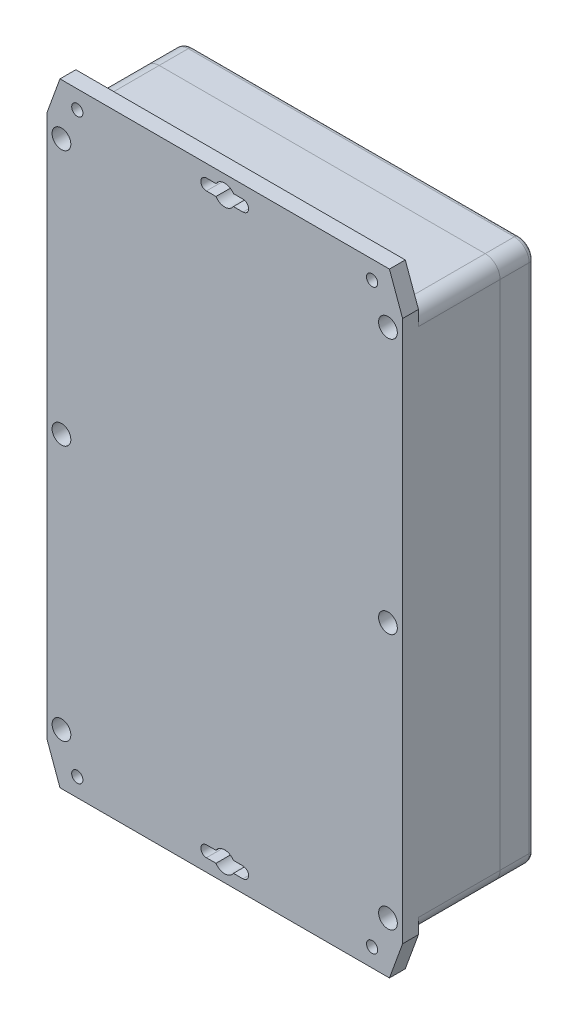
from build123d import *

# Parameters (mm, degrees)
SKETCH2_W                             = 146.05
SKETCH2_H                             = 251.9934
SKETCH2_R                             = 2.2987
BOSS_EXTRUDE1_DEPTH                   = 6.5024
CUT_EXTRUDE1_DEPTH                    = 146.774141197
BOSS_EXTRUDE2_START                   = -33.5026
SKETCH4_W                             = 146.05
SKETCH4_H                             = 222.25
BOSS_EXTRUDE2_DEPTH                   = 33.5026
SKETCH5_R                             = 3.8481
CUT_EXTRUDE2_DEPTH                    = 24.003
SKETCH6_R                             = 2.2225
CUT_EXTRUDE3_DEPTH                    = 148.593912628
CUT_EXTRUDE4_DEPTH                    = 37.0078
SKETCH9_R                             = 3.0099
SKETCH9_R_2                           = 1.2446
BOSS_EXTRUDE3_DEPTH                   = 7.493
FILLET2_R                             = 6.1214
BOSS_EXTRUDE4_DEPTH                   = 13.97
CUT_EXTRUDE5_START                    = -3.2004
SKETCH12_R                            = 3.8481
CUT_EXTRUDE5_DEPTH                    = 3.2004
SHELL1_START                          = -50.9778
SHELL1_DEPTH                          = 10.9728
SHELL1_START_2                        = -47.7774
SHELL1_2_DEPTH                        = 7.7724
FILLET3_R                             = 2.032
SKETCH13_R                            = 3.5941
BOSS_EXTRUDE6_DEPTH                   = 2.286
BOSS_EXTRUDE6_2_DEPTH                 = 2.286
BOSS_EXTRUDE6_3_DEPTH                 = 2.286
BOSS_EXTRUDE6_4_DEPTH                 = 2.286
BOSS_EXTRUDE6_5_DEPTH                 = 2.286
BOSS_EXTRUDE6_6_DEPTH                 = 2.286
BOSS_EXTRUDE7_START                   = 29.8196
SKETCH14_R                            = 2.2225
BOSS_EXTRUDE7_DEPTH                   = 29.8196
FILLET4_R                             = 1.27
SKETCH15_W                            = 1.524
SKETCH15_H                            = 222.25
CUT_EXTRUDE_THIN1_DEPTH               = 1.524
F_19_5_19_5_DIAMETER_HOLE1_AT_2_COUNT = 2
F_19_5_19_5_DIAMETER_HOLE1_AT_2_PITCH = 50.8


# Read off the part's stored shape, not the designer's step: Shell1
with BuildPart() as part:
    # Sketch2 → Boss-Extrude1 (new body)
    with BuildSketch(Plane.XY):
        Rectangle(SKETCH2_W, SKETCH2_H)
        with Locations((60.5028, 118.5037)):
            Circle(SKETCH2_R, mode=Mode.SUBTRACT)
        with Locations((-60.5028, 118.5037)):
            Circle(SKETCH2_R, mode=Mode.SUBTRACT)
        with Locations((-60.5028, -118.5037)):
            Circle(SKETCH2_R, mode=Mode.SUBTRACT)
        with Locations((60.5028, -118.5037)):
            Circle(SKETCH2_R, mode=Mode.SUBTRACT)
        with BuildLine():
            Line((-7.5057, -120.8024), (-3.580048681, -120.8024))
            ThreePointArc((-3.580048681, -120.8024), (0, -122.7582), (3.580048681, -120.8024))
            Line((3.580048681, -120.8024), (7.5057, -120.8024))
            ThreePointArc((7.5057, -120.8024), (9.8044, -118.5037), (7.5057, -116.205))
            Line((7.5057, -116.205), (3.580048681, -116.205))
            ThreePointArc((3.580048681, -116.205), (0, -114.2492), (-3.580048681, -116.205))
            Line((-3.580048681, -116.205), (-7.5057, -116.205))
            ThreePointArc((-7.5057, -116.205), (-9.8044, -118.5037), (-7.5057, -120.8024))
        make_face(mode=Mode.SUBTRACT)
        with BuildLine():
            Line((-3.580048681, 120.8024), (-7.5057, 120.8024))
            ThreePointArc((-7.5057, 120.8024), (-9.8044, 118.5037), (-7.5057, 116.205))
            Line((-7.5057, 116.205), (-3.580048681, 116.205))
            ThreePointArc((-3.580048681, 116.205), (0, 114.2492), (3.580048681, 116.205))
            Line((3.580048681, 116.205), (7.5057, 116.205))
            ThreePointArc((7.5057, 116.205), (9.8044, 118.5037), (7.5057, 120.8024))
            Line((7.5057, 120.8024), (3.580048681, 120.8024))
            ThreePointArc((3.580048681, 120.8024), (0, 122.7582), (-3.580048681, 120.8024))
        make_face(mode=Mode.SUBTRACT)
    extrude(amount=-BOSS_EXTRUDE1_DEPTH)

    # Sketch3 → Cut-Extrude1 (cut, through all)
    with BuildSketch(Plane(origin=(0, 0, -6.5024), x_dir=(-1, 0, 0), z_dir=(0, 0, -1))):
        Polygon((73.025, 111.125), (67.612143867, 125.9967), (73.025, 125.9967), align=None)
        Polygon((-73.025, 111.125), (-67.612143867, 125.9967), (-73.025, 125.9967), align=None)
        Polygon((73.025, -111.125), (67.612143867, -125.9967), (73.025, -125.9967), align=None)
        Polygon((-73.025, -111.125), (-67.612143867, -125.9967), (-73.025, -125.9967), align=None)
    extrude(amount=-CUT_EXTRUDE1_DEPTH, mode=Mode.SUBTRACT)

    # Sketch4 → Boss-Extrude2 (add)
    with BuildSketch(Plane.XY.offset(-6.5024).offset(BOSS_EXTRUDE2_START)):
        Rectangle(SKETCH4_W, SKETCH4_H)
    extrude(amount=BOSS_EXTRUDE2_DEPTH)

    # Sketch5 → Cut-Extrude2 (cut)
    with BuildSketch(Plane(origin=(0, 0, 0), x_dir=(-1, 0, 0), z_dir=(0, 0, -1))):
        with Locations((67.0052, 105.0036)):
            Circle(SKETCH5_R)
        with Locations((-67.0052, 105.0036)):
            Circle(SKETCH5_R)
        with Locations((-67.0052, -105.0036)):
            Circle(SKETCH5_R)
        with Locations((67.0052, -105.0036)):
            Circle(SKETCH5_R)
        with Locations((-67.0052, 0)):
            Circle(SKETCH5_R)
        with Locations((67.0052, 0)):
            Circle(SKETCH5_R)
    extrude(amount=CUT_EXTRUDE2_DEPTH, mode=Mode.SUBTRACT)

    # Sketch6 → Cut-Extrude3 (cut, through all)
    with BuildSketch(Plane.XY.offset(-24.003)):
        with Locations((-67.0052, 105.0036)):
            Circle(SKETCH6_R)
        with Locations((67.0052, 105.0036)):
            Circle(SKETCH6_R)
        with Locations((67.0052, -105.0036)):
            Circle(SKETCH6_R)
        with Locations((-67.0052, -105.0036)):
            Circle(SKETCH6_R)
        with Locations((67.0052, 0)):
            Circle(SKETCH6_R)
        with Locations((-67.0052, 0)):
            Circle(SKETCH6_R)
    extrude(amount=-CUT_EXTRUDE3_DEPTH, mode=Mode.SUBTRACT)

    # Sketch8 → Cut-Extrude4 (cut)
    with BuildSketch(Plane(origin=(0, 0, -40.005), x_dir=(-1, 0, 0), z_dir=(0, 0, -1))):
        with BuildLine():
            Line((-67.0052, -6.1214), (-70.485, -6.1214))
            Line((-70.485, -6.1214), (-70.485, -95.4024))
            ThreePointArc((-70.485, -95.4024), (-69.465790177, -97.862990177), (-67.0052, -98.8822))
            Line((-67.0052, -98.8822), (-56.3499, -98.8822))
            ThreePointArc((-56.3499, -98.8822), (-52.919442162, -100.303142162), (-51.4985, -103.7336))
            ThreePointArc((-51.4985, -103.7336), (-50.077557838, -107.164057838), (-46.6471, -108.585))
            Line((-46.6471, -108.585), (46.6471, -108.585))
            ThreePointArc((46.6471, -108.585), (50.077557838, -107.164057838), (51.4985, -103.7336))
            ThreePointArc((51.4985, -103.7336), (52.919442162, -100.303142162), (56.3499, -98.8822))
            Line((56.3499, -98.8822), (67.0052, -98.8822))
            ThreePointArc((67.0052, -98.8822), (69.465790177, -97.862990177), (70.485, -95.4024))
            Line((70.485, -95.4024), (70.485, -6.1214))
            Line((70.485, -6.1214), (67.0052, -6.1214))
            ThreePointArc((67.0052, -6.1214), (60.8838, 0), (67.0052, 6.1214))
            Line((67.0052, 6.1214), (70.485, 6.1214))
            Line((70.485, 6.1214), (70.485, 95.4024))
            ThreePointArc((70.485, 95.4024), (69.465790177, 97.862990177), (67.0052, 98.8822))
            Line((67.0052, 98.8822), (56.3499, 98.8822))
            ThreePointArc((56.3499, 98.8822), (52.919442162, 100.303142162), (51.4985, 103.7336))
            ThreePointArc((51.4985, 103.7336), (50.077557838, 107.164057838), (46.6471, 108.585))
            Line((46.6471, 108.585), (-46.6471, 108.585))
            ThreePointArc((-46.6471, 108.585), (-50.077557838, 107.164057838), (-51.4985, 103.7336))
            ThreePointArc((-51.4985, 103.7336), (-52.919442162, 100.303142162), (-56.3499, 98.8822))
            Line((-56.3499, 98.8822), (-67.0052, 98.8822))
            ThreePointArc((-67.0052, 98.8822), (-69.465790177, 97.862990177), (-70.485, 95.4024))
            Line((-70.485, 95.4024), (-70.485, 6.1214))
            Line((-70.485, 6.1214), (-67.0052, 6.1214))
            ThreePointArc((-67.0052, 6.1214), (-60.8838, 0), (-67.0052, -6.1214))
        make_face()
    extrude(amount=-CUT_EXTRUDE4_DEPTH, mode=Mode.SUBTRACT)

    # Sketch9 → Boss-Extrude3 (add)
    # profile 1 of 8: a face of its own
    with BuildSketch(Plane(origin=(0, 0, 0), x_dir=(-1, 0, 0), z_dir=(0, 0, -1))):
        with Locations(Location((-57.7469, 90.7542, 0), (0, 0, 180))):
            Circle(SKETCH9_R)
        with Locations(Location((-57.7469, 90.7542, 0), (0, 0, 180))):
            Circle(SKETCH9_R_2, mode=Mode.SUBTRACT)
    # profile 2 of 8: a face of its own
    with BuildSketch(Plane(origin=(0, 0, 0), x_dir=(-1, 0, 0), z_dir=(0, 0, -1))):
        with Locations(Location((57.7469, 90.7542, 0), (0, 0, 180))):
            Circle(SKETCH9_R)
        with Locations(Location((57.7469, 90.7542, 0), (0, 0, 180))):
            Circle(SKETCH9_R_2, mode=Mode.SUBTRACT)
    # profile 3 of 8: a face of its own
    with BuildSketch(Plane(origin=(0, 0, 0), x_dir=(-1, 0, 0), z_dir=(0, 0, -1))):
        with Locations(Location((-19.4945, 82.9945, 0), (0, 0, 180))):
            Circle(SKETCH9_R)
        with Locations(Location((-19.4945, 82.9945, 0), (0, 0, 180))):
            Circle(SKETCH9_R_2, mode=Mode.SUBTRACT)
    # profile 4 of 8: a face of its own
    with BuildSketch(Plane(origin=(0, 0, 0), x_dir=(-1, 0, 0), z_dir=(0, 0, -1))):
        with Locations(Location((19.4945, 82.9945, 0), (0, 0, 180))):
            Circle(SKETCH9_R)
        with Locations(Location((19.4945, 82.9945, 0), (0, 0, 180))):
            Circle(SKETCH9_R_2, mode=Mode.SUBTRACT)
    # profile 5 of 8: a face of its own
    with BuildSketch(Plane(origin=(0, 0, 0), x_dir=(-1, 0, 0), z_dir=(0, 0, -1))):
        with Locations(Location((57.7469, -90.7542, 0), (0, 0, 180))):
            Circle(SKETCH9_R)
        with Locations(Location((57.7469, -90.7542, 0), (0, 0, 180))):
            Circle(SKETCH9_R_2, mode=Mode.SUBTRACT)
    # profile 6 of 8: a face of its own
    with BuildSketch(Plane(origin=(0, 0, 0), x_dir=(-1, 0, 0), z_dir=(0, 0, -1))):
        with Locations(Location((-19.4945, -82.9945, 0), (0, 0, 180))):
            Circle(SKETCH9_R)
        with Locations(Location((-19.4945, -82.9945, 0), (0, 0, 180))):
            Circle(SKETCH9_R_2, mode=Mode.SUBTRACT)
    # profile 7 of 8: a face of its own
    with BuildSketch(Plane(origin=(0, 0, 0), x_dir=(-1, 0, 0), z_dir=(0, 0, -1))):
        with Locations(Location((-57.7469, -90.7542, 0), (0, 0, 180))):
            Circle(SKETCH9_R)
        with Locations(Location((-57.7469, -90.7542, 0), (0, 0, 180))):
            Circle(SKETCH9_R_2, mode=Mode.SUBTRACT)
    # profile 8 of 8: a face of its own
    with BuildSketch(Plane(origin=(0, 0, 0), x_dir=(-1, 0, 0), z_dir=(0, 0, -1))):
        with Locations(Location((19.4945, -82.9945, 0), (0, 0, 180))):
            Circle(SKETCH9_R)
        with Locations(Location((19.4945, -82.9945, 0), (0, 0, 180))):
            Circle(SKETCH9_R_2, mode=Mode.SUBTRACT)
    extrude(amount=BOSS_EXTRUDE3_DEPTH)

    # Fillet2
    fillet2_edges = [part.edges().sort_by_distance(p)[0] for p in [
        (-73.025, -111.125, -23.2537),
        (-73.025, 111.125, -23.2537),
        (73.025, 111.125, -23.2537),
        (73.025, -111.125, -23.2537),
    ]]
    fillet(fillet2_edges, radius=FILLET2_R)



with BuildPart() as body_2:
    # Sketch11 → Boss-Extrude4 (new body)
    with BuildSketch(Plane(origin=(0, 0, -40.005), x_dir=(-1, 0, 0), z_dir=(0, 0, -1))):
        with BuildLine():
            Line((-73.025, 105.0036), (-73.025, -105.0036))
            ThreePointArc((-73.025, -105.0036), (-71.23208345, -109.33208345), (-66.9036, -111.125))
            Line((-66.9036, -111.125), (66.9036, -111.125))
            ThreePointArc((66.9036, -111.125), (71.23208345, -109.33208345), (73.025, -105.0036))
            Line((73.025, -105.0036), (73.025, 105.0036))
            ThreePointArc((73.025, 105.0036), (71.23208345, 109.33208345), (66.9036, 111.125))
            Line((66.9036, 111.125), (-66.9036, 111.125))
            ThreePointArc((-66.9036, 111.125), (-71.23208345, 109.33208345), (-73.025, 105.0036))
        make_face()
    extrude(amount=BOSS_EXTRUDE4_DEPTH)

    # Sketch12 → Cut-Extrude5 (cut)
    with BuildSketch(Plane(origin=(0, 0, -53.975), x_dir=(-1, 0, 0), z_dir=(0, 0, -1)).offset(CUT_EXTRUDE5_START)):
        with Locations((-67.0052, 105.0036)):
            Circle(SKETCH12_R)
        with Locations((67.0052, 105.0036)):
            Circle(SKETCH12_R)
        with Locations((67.0052, -105.0036)):
            Circle(SKETCH12_R)
        with Locations((-67.0052, -105.0036)):
            Circle(SKETCH12_R)
        with Locations((-67.0052, 0)):
            Circle(SKETCH12_R)
        with Locations((67.0052, 0)):
            Circle(SKETCH12_R)
    extrude(amount=CUT_EXTRUDE5_DEPTH, mode=Mode.SUBTRACT)

    # Shell1 outline → Shell1 (cut)
    with BuildSketch(Plane.XY.offset(SHELL1_START)):
        with BuildLine():
            Line((-60.914427762, -108.1278), (60.914427762, -108.1278))
            ThreePointArc((60.914427762, -108.1278), (62.124807835, -100.203609958), (70.0278, -98.86177443))
            Line((70.0278, -98.86177443), (70.0278, -6.14182557))
            ThreePointArc((70.0278, -6.14182557), (60.1599, 0), (70.0278, 6.14182557))
            Line((70.0278, 6.14182557), (70.0278, 98.86177443))
            ThreePointArc((70.0278, 98.86177443), (62.124807835, 100.203609958), (60.914427762, 108.1278))
            Line((60.914427762, 108.1278), (-60.914427762, 108.1278))
            ThreePointArc((-60.914427762, 108.1278), (-62.124807835, 100.203609958), (-70.0278, 98.86177443))
            Line((-70.0278, 98.86177443), (-70.0278, 6.14182557))
            ThreePointArc((-70.0278, 6.14182557), (-60.1599, 0), (-70.0278, -6.14182557))
            Line((-70.0278, -6.14182557), (-70.0278, -98.86177443))
            ThreePointArc((-70.0278, -98.86177443), (-62.124807835, -100.203609958), (-60.914427762, -108.1278))
        make_face()
    extrude(amount=SHELL1_DEPTH, mode=Mode.SUBTRACT)

    # Shell1 2 outline → Shell1 2 (cut)
    with BuildSketch(Plane.XY.offset(SHELL1_START_2)):
        with BuildLine():
            Line((60.914427762, -108.1278), (66.9036, -108.1278))
            ThreePointArc((66.9036, -108.1278), (69.112743006, -107.212743006), (70.0278, -105.0036))
            Line((70.0278, -105.0036), (70.0278, -98.86177443))
            ThreePointArc((70.0278, -98.86177443), (62.124807835, -100.203609958), (60.914427762, -108.1278))
        make_face()
        with BuildLine():
            Line((-66.9036, -108.1278), (-60.914427762, -108.1278))
            ThreePointArc((-60.914427762, -108.1278), (-62.124807835, -100.203609958), (-70.0278, -98.86177443))
            Line((-70.0278, -98.86177443), (-70.0278, -105.0036))
            ThreePointArc((-70.0278, -105.0036), (-69.112743006, -107.212743006), (-66.9036, -108.1278))
        make_face()
        with BuildLine():
            ThreePointArc((70.0278, 6.14182557), (60.1599, 0), (70.0278, -6.14182557))
            Line((70.0278, -6.14182557), (70.0278, 6.14182557))
        make_face()
        with BuildLine():
            Line((-70.0278, 6.14182557), (-70.0278, -6.14182557))
            ThreePointArc((-70.0278, -6.14182557), (-60.1599, 0), (-70.0278, 6.14182557))
        make_face()
        with BuildLine():
            ThreePointArc((60.914427762, 108.1278), (62.124807835, 100.203609958), (70.0278, 98.86177443))
            Line((70.0278, 98.86177443), (70.0278, 105.0036))
            ThreePointArc((70.0278, 105.0036), (69.112743006, 107.212743006), (66.9036, 108.1278))
            Line((66.9036, 108.1278), (60.914427762, 108.1278))
        make_face()
        with BuildLine():
            Line((-70.0278, 105.0036), (-70.0278, 98.86177443))
            ThreePointArc((-70.0278, 98.86177443), (-62.124807835, 100.203609958), (-60.914427762, 108.1278))
            Line((-60.914427762, 108.1278), (-66.9036, 108.1278))
            ThreePointArc((-66.9036, 108.1278), (-69.112743006, 107.212743006), (-70.0278, 105.0036))
        make_face()
    extrude(amount=SHELL1_2_DEPTH, mode=Mode.SUBTRACT)

    # Fillet3
    fillet3_edges = [body_2.edges().sort_by_distance(p)[0] for p in [
        (71.23208345, -109.33208345, -53.975),
        (0, -111.125, -53.975),
        (-71.23208345, -109.33208345, -53.975),
        (-73.025, 0, -53.975),
        (-71.23208345, 109.33208345, -53.975),
        (0, 111.125, -53.975),
        (71.23208345, 109.33208345, -53.975),
        (73.025, 0, -53.975),
    ]]
    fillet(fillet3_edges, radius=FILLET3_R)


with BuildPart() as body_3:
    # Sketch13 → Boss-Extrude6 (new body)
    with BuildSketch(Plane(origin=(0, 0, -50.7746), x_dir=(-1, 0, 0), z_dir=(0, 0, -1))):
        with Locations((-67.0052, 0)):
            Circle(SKETCH13_R)
    extrude(amount=BOSS_EXTRUDE6_DEPTH)


with BuildPart() as body_4:
    # Sketch13 → Boss-Extrude6 2 (new body)
    with BuildSketch(Plane(origin=(0, 0, -50.7746), x_dir=(-1, 0, 0), z_dir=(0, 0, -1))):
        with Locations((67.0052, 105.0036)):
            Circle(SKETCH13_R)
    extrude(amount=BOSS_EXTRUDE6_2_DEPTH)


with BuildPart() as body_5:
    # Sketch13 → Boss-Extrude6 3 (new body)
    with BuildSketch(Plane(origin=(0, 0, -50.7746), x_dir=(-1, 0, 0), z_dir=(0, 0, -1))):
        with Locations((-67.0052, 105.0036)):
            Circle(SKETCH13_R)
    extrude(amount=BOSS_EXTRUDE6_3_DEPTH)


with BuildPart() as body_6:
    # Sketch13 → Boss-Extrude6 4 (new body)
    with BuildSketch(Plane(origin=(0, 0, -50.7746), x_dir=(-1, 0, 0), z_dir=(0, 0, -1))):
        with Locations((67.0052, -105.0036)):
            Circle(SKETCH13_R)
    extrude(amount=BOSS_EXTRUDE6_4_DEPTH)


with BuildPart() as body_7:
    # Sketch13 → Boss-Extrude6 5 (new body)
    with BuildSketch(Plane(origin=(0, 0, -50.7746), x_dir=(-1, 0, 0), z_dir=(0, 0, -1))):
        with Locations((-67.0052, -105.0036)):
            Circle(SKETCH13_R)
    extrude(amount=BOSS_EXTRUDE6_5_DEPTH)


with BuildPart() as body_8:
    # Sketch13 → Boss-Extrude6 6 (new body)
    with BuildSketch(Plane(origin=(0, 0, -50.7746), x_dir=(-1, 0, 0), z_dir=(0, 0, -1))):
        with Locations((67.0052, 0)):
            Circle(SKETCH13_R)
    extrude(amount=BOSS_EXTRUDE6_6_DEPTH)


with BuildPart() as part_1:
    add(part.part)

    add(body_4.part)  # Boss-Extrude7 merges body 4

    add(body_6.part)  # Boss-Extrude7 merges body 6

    add(body_7.part)  # Boss-Extrude7 merges body 7

    add(body_5.part)  # Boss-Extrude7 merges body 5

    add(body_3.part)  # Boss-Extrude7 merges body 3

    add(body_8.part)  # Boss-Extrude7 merges body 8
    # Sketch14 → Boss-Extrude7 (add)
    with BuildSketch(Plane.XY.offset(-50.7746).offset(BOSS_EXTRUDE7_START)):
        with Locations(Location((-67.0052, 105.0036, 0), (0, 0, 180))):
            Circle(SKETCH14_R)
        with Locations(Location((-67.0052, -105.0036, 0), (0, 0, 180))):
            Circle(SKETCH14_R)
        with Locations(Location((67.0052, -105.0036, 0), (0, 0, 180))):
            Circle(SKETCH14_R)
        with Locations(Location((67.0052, 105.0036, 0), (0, 0, 180))):
            Circle(SKETCH14_R)
        with Locations(Location((67.0052, 0, 0), (0, 0, 180))):
            Circle(SKETCH14_R)
        with Locations(Location((-67.0052, 0, 0), (0, 0, 180))):
            Circle(SKETCH14_R)
    extrude(amount=-BOSS_EXTRUDE7_DEPTH)

    # Fillet4
    fillet4_edges = [part_1.edges().sort_by_distance(p)[0] for p in [
        (-63.4111, 105.0036, -53.0606),
        (-63.4111, -105.0036, -53.0606),
        (70.5993, -105.0036, -53.0606),
        (70.5993, 105.0036, -53.0606),
        (70.5993, 0, -53.0606),
        (-63.4111, 0, -53.0606),
    ]]
    fillet(fillet4_edges, radius=FILLET4_R)

    # Sketch15 → Cut-Extrude-Thin1 (cut)
    with BuildSketch(Plane(origin=(0, 0, -53.0606), x_dir=(-1, 0, 0), z_dir=(0, 0, -1))):
        with Locations((-67.0052, 0)):
            Rectangle(SKETCH15_W, SKETCH15_H)
    cut_extrude_thin1 = extrude(amount=-CUT_EXTRUDE_THIN1_DEPTH, mode=Mode.SUBTRACT)

    # Mirror1: Cut-Extrude-Thin1 across plane
    add(cut_extrude_thin1.mirror(Plane(origin=(0, 0, 0), x_dir=(0, 0, 1), z_dir=(1, 0, 0))), mode=Mode.SUBTRACT)

    # Sketch21 → Ø19.5 (19.5) Diameter Hole1 (revolve, cut)
    with BuildSketch(Plane(origin=(25.4, -111.125, -23.2537), x_dir=(0, 0, -1), z_dir=(1, 0, 0))):
        Polygon((0, 0), (0, 31.258391036), (9.75, 25.4), (9.75, 0), align=None)
    f_19_5_19_5_diameter_hole1 = revolve(axis=Axis((25.4, -117.475, -23.2537), (0, 1, 0)), mode=Mode.SUBTRACT)

    # Ø19.5 (19.5) Diameter Hole1 at 2: Ø19.5 (19.5) Diameter Hole1 ×2
    with Locations(*[(-i * F_19_5_19_5_DIAMETER_HOLE1_AT_2_PITCH, 0, 0) for i in range(1, F_19_5_19_5_DIAMETER_HOLE1_AT_2_COUNT)]):
        add(f_19_5_19_5_diameter_hole1, mode=Mode.SUBTRACT)


with BuildPart() as body_3_2:
    # Sweep1: sweep along a path in Sketch16
    with BuildLine(Plane(origin=(0, 0, -40.005), x_dir=(-1, 0, 0), z_dir=(0, 0, -1))) as sweep1_path:
        Line((46.6471, 108.585), (-46.6471, 108.585))
        ThreePointArc((-46.6471, 108.585), (-50.077557838, 107.164057838), (-51.4985, 103.7336))
        ThreePointArc((-51.4985, 103.7336), (-52.919442162, 100.303142162), (-56.3499, 98.8822))
        Line((-56.3499, 98.8822), (-67.0052, 98.8822))
        ThreePointArc((-67.0052, 98.8822), (-69.465790177, 97.862990177), (-70.485, 95.4024))
        Line((-70.485, 95.4024), (-70.485, -95.4024))
        ThreePointArc((-70.485, -95.4024), (-69.465790177, -97.862990177), (-67.0052, -98.8822))
        Line((-67.0052, -98.8822), (-56.3499, -98.8822))
        ThreePointArc((-56.3499, -98.8822), (-52.919442162, -100.303142162), (-51.4985, -103.7336))
        ThreePointArc((-51.4985, -103.7336), (-50.077557838, -107.164057838), (-46.6471, -108.585))
        Line((-46.6471, -108.585), (46.6471, -108.585))
        ThreePointArc((46.6471, -108.585), (50.077557838, -107.164057838), (51.4985, -103.7336))
        ThreePointArc((51.4985, -103.7336), (52.919442162, -100.303142162), (56.3499, -98.8822))
        Line((56.3499, -98.8822), (67.0052, -98.8822))
        ThreePointArc((67.0052, -98.8822), (69.465790177, -97.862990177), (70.485, -95.4024))
        Line((70.485, -95.4024), (70.485, 95.4024))
        ThreePointArc((70.485, 95.4024), (69.465790177, 97.862990177), (67.0052, 98.8822))
        Line((67.0052, 98.8822), (56.3499, 98.8822))
        ThreePointArc((56.3499, 98.8822), (52.919442162, 100.303142162), (51.4985, 103.7336))
        ThreePointArc((51.4985, 103.7336), (50.077557838, 107.164057838), (46.6471, 108.585))
    # Sketch17 → Sweep1 (sweep)
    with BuildSketch(Plane(origin=(0, 95.4024, 0), x_dir=(-1, 0, 0), z_dir=(0, 1, 0))):
        with BuildLine():
            Line((-71.755, -40.005), (-70.485, -40.005))
            ThreePointArc((-70.485, -40.005), (-71.12, -40.64), (-71.755, -40.005))
        make_face()
    sweep(path=sweep1_path.line)


solid = Compound([body_2.part, part_1.part, body_3_2.part])
